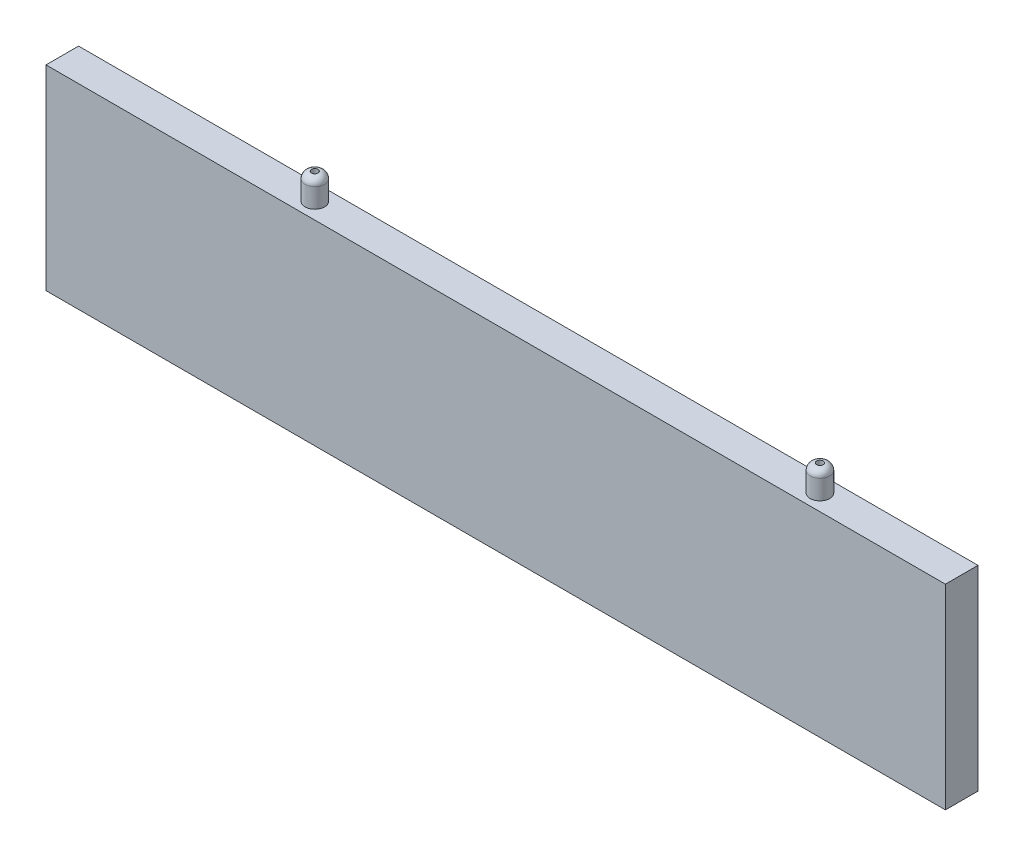
from build123d import *

# Parameters (mm, degrees)
ESQUISSE1_W             = 155
ESQUISSE1_H             = 30
BOSS_EXTRU_1_DEPTH      = 5
ESQUISSE2_R             = 1.5
ESQUISSE2_R_2           = 0.5
BOSS_EXTRU_2_DEPTH      = 4
CONG_1_R                = 1
ESQUISSE4_W             = 5
ESQUISSE4_H             = 30
ENL_V_MAT_EXTRU_2_DEPTH = 17


with BuildPart() as part:
    # Esquisse1 → Boss.-Extru.1 (new body)
    with BuildSketch(Plane.XY):
        Rectangle(ESQUISSE1_W, ESQUISSE1_H)
    extrude(amount=BOSS_EXTRU_1_DEPTH)

    # Esquisse2 → Boss.-Extru.2 (add)
    # profile 1 of 2: a face of its own
    with BuildSketch(Plane(origin=(0, 15, 0), x_dir=(1, 0, 0), z_dir=(0, 1, 0))):
        with Locations(Location((-38.75, -2.5, 0), (0, 0, 90))):
            Circle(ESQUISSE2_R)
        with Locations(Location((-38.75, -2.5, 0), (0, 0, 270))):
            Circle(ESQUISSE2_R_2, mode=Mode.SUBTRACT)
    # profile 2 of 2: a face of its own
    with BuildSketch(Plane(origin=(0, 15, 0), x_dir=(1, 0, 0), z_dir=(0, 1, 0))):
        with Locations(Location((38.75, -2.5, 0), (0, 0, 90))):
            Circle(ESQUISSE2_R)
        with Locations(Location((38.75, -2.5, 0), (0, 0, 270))):
            Circle(ESQUISSE2_R_2, mode=Mode.SUBTRACT)
    extrude(amount=BOSS_EXTRU_2_DEPTH)

    # Congé1
    cong_1_edges = [part.edges().sort_by_distance(p)[0] for p in [
        (-38.75, 19, 4),
        (38.75, 19, 4),
    ]]
    fillet(cong_1_edges, radius=CONG_1_R - 0.0001)  # a hair under: the kernel refuses the full size

    # Esquisse4 → Enlèv. mat.-Extru.2 (cut)
    with BuildSketch(Plane(origin=(77.5, 0, 0), x_dir=(0, 0, -1), z_dir=(1, 0, 0))):
        with Locations((-2.5, 0)):
            Rectangle(ESQUISSE4_W, ESQUISSE4_H)
    extrude(amount=-ENL_V_MAT_EXTRU_2_DEPTH, mode=Mode.SUBTRACT)


solid = part.part
